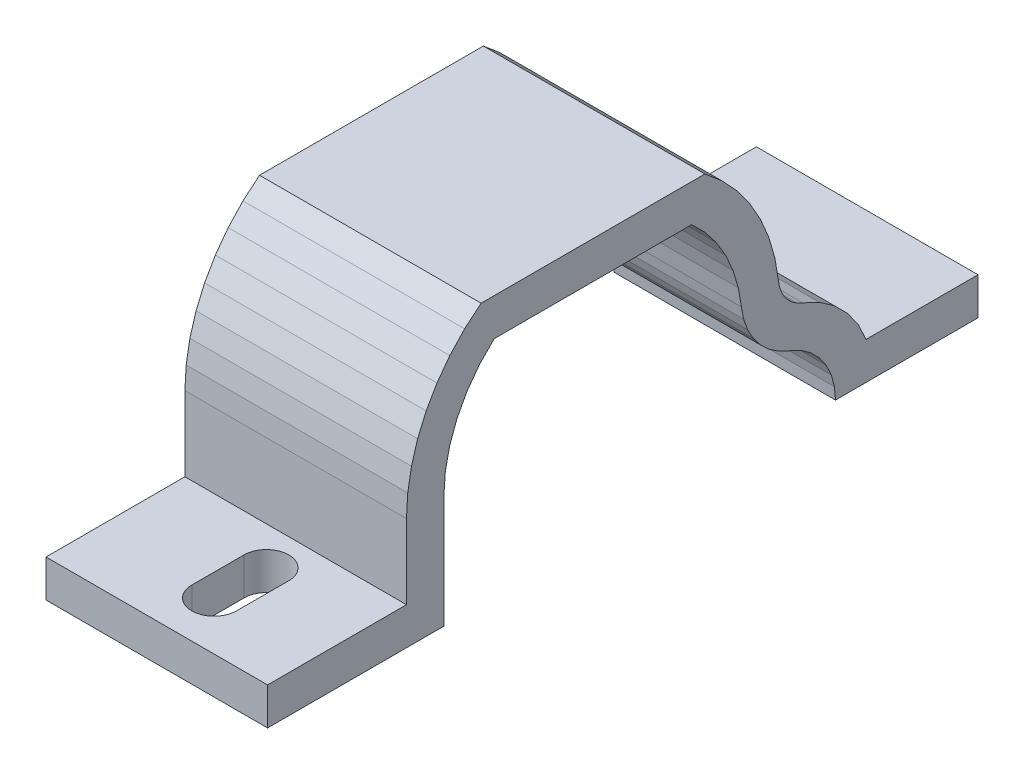
from build123d import *

# Parameters (mm, degrees)
CUT_EXTRUDE1_START   = -0.299999985
CUT_EXTRUDE1_DEPTH   = 0.099999976
CUT_EXTRUDE1_2_DEPTH = 0.624999986
CUT_EXTRUDE2_REACH   = 3.369
CUT_EXTRUDE3_DEPTH   = 0.099999976
CUT_EXTRUDE4_DEPTH   = 2.439835087
SKETCH8_W            = 0.45707022
SKETCH8_H            = 0.126497466
CUT_EXTRUDE5_DEPTH   = 2.36862159
BOSS_EXTRUDE1_DEPTH  = 0.3
SKETCH10_W           = 0.320867719
SKETCH10_H           = 0.471779159
BOSS_EXTRUDE2_DEPTH  = 0.1
CUT_EXTRUDE6_DEPTH   = 2.347497156
SKETCH12_W           = 0.905202631
SKETCH12_H           = 0.17588134
CUT_EXTRUDE7_DEPTH   = 2.347497156
SKETCH13_W           = 2.413938714
SKETCH13_H           = 1.247285026
CUT_EXTRUDE8_DEPTH   = 0.03
SKETCH14_W           = 2.254507246
SKETCH14_H           = 1.130570224
CUT_EXTRUDE9_DEPTH   = 0.001
SCALE1_SCALE         = 26


with BuildPart() as part:
    # Cut-Extrude1: read off the stored shape, not the designer's step
    # Cut-Extrude1 outline → Cut-Extrude1 (new body)
    with BuildSketch(Plane(origin=(0, 0, 0), x_dir=(-1, 0, 0), z_dir=(0, 1, 0)).offset(CUT_EXTRUDE1_START)):
        Polygon((-0.103293976, 1.023100922), (-0.125000006, 1.025000005), (-0.500000024, 1.025000005), (-0.52170601, 1.023100922), (-0.542752503, 1.017461531), (-0.562499976, 1.008253195), (-0.580348424, 0.995755661), (-0.595755526, 0.980348443), (-0.608253176, 0.962500053), (-0.61746157, 0.942752522), (-0.623101019, 0.921706087), (-0.624999986, 0.899999985), (-0.624999986, -1.025000005), (-0.623101019, -1.046706107), (-0.61746157, -1.067752484), (-0.608253176, -1.087500015), (-0.595755526, -1.105348463), (-0.580348424, -1.120755565), (-0.562499976, -1.133253216), (-0.542752503, -1.142461551), (-0.52170601, -1.148100942), (-0.500000024, -1.150000026), (-0.125000006, -1.150000026), (-0.103293976, -1.148100942), (-0.082247483, -1.142461551), (-0.062500003, -1.133253216), (-0.044651548, -1.120755565), (-0.029244446, -1.105348463), (-0.016746824, -1.087500015), (-0.007538422, -1.067752484), (-0.001899031, -1.046706107), (0, -1.025000005), (0, 0.899999985), (-0.001899031, 0.921706087), (-0.007538422, 0.942752522), (-0.016746824, 0.962500053), (-0.029244446, 0.980348443), (-0.044651548, 0.995755661), (-0.062500003, 1.008253195), (-0.082247483, 1.017461531), align=None)
    extrude(amount=CUT_EXTRUDE1_DEPTH)

    # Cut-Extrude1 2 outline → Cut-Extrude1 2 (add)
    with BuildSketch(Plane.YZ):
        Polygon((0.057826259, 0.496644876), (0, 0.500000024), (-0.200000009, 0.500000024), (-0.200000009, -0.73204824), (-0.155237081, -0.710894703), (-0.114767128, -0.682375045), (-0.079790305, -0.647334848), (-0.051343839, -0.60681341), (-0.030271342, -0.562012312), (-0.023619925, -0.547616393), (-0.014776401, -0.534452964), (-0.003963165, -0.522853108), (0.008547848, -0.513108505), (0.022442007, -0.505464152), (0.037369897, -0.500112365), (0.0529561, -0.497187721), (0.110784524, -0.487572339), (0.167090067, -0.471254607), (0.22109873, -0.448458857), (0.272068108, -0.41949845), (0.319297513, -0.384771498), (0.362137827, -0.344755303), (0.400000019, -0.299999985), (0.400000019, 0.299999985), (0.362620107, 0.344247906), (0.320373714, 0.383875886), (0.273827725, 0.418351992), (0.223606796, 0.447213592), (0.170384956, 0.47007337), (0.114876457, 0.486624485), align=None)
    extrude(amount=CUT_EXTRUDE1_2_DEPTH)

    # Sketch2 → Cut-Extrude2 (cut, up to next)
    with BuildSketch(Plane.ZY, mode=Mode.PRIVATE) as cut_extrude2_sk1:
        Polygon((-0.65000006, -0.299999985), (0.400000019, -0.299999985), (0.400000019, 0), (0.396011048, 0.056349407), (0.384123705, 0.11157494), (0.364575157, 0.164575133), (0.337755162, 0.214292915), (0.304198737, 0.259736669), (0.264575152, 0.299999985), (-0.264575152, 0.299999985), (-0.299557927, 0.265075563), (-0.329965871, 0.226102915), (-0.355334574, 0.183677243), (-0.375276693, 0.138446456), (-0.389487541, 0.091101319), (-0.397750206, 0.042364885), (-0.403599464, 0.011192467), (-0.414303038, -0.01866331), (-0.429591688, -0.046451623), (-0.449080922, -0.07147366), (-0.472280721, -0.093100134), (-0.498607522, -0.110787172), (-0.527399301, -0.124090002), (-0.556858547, -0.137973097), (-0.583471148, -0.15674415), (-0.606434362, -0.179836949), (-0.625055342, -0.20655476), (-0.638772442, -0.236091611), (-0.647171808, -0.267556432), align=None)
    cut_extrude2_tool1 = extrude(cut_extrude2_sk1.sketch, amount=-CUT_EXTRUDE2_REACH, mode=Mode.PRIVATE) & part.part
    add(cut_extrude2_tool1.solids().sort_by_distance((0, -0.029264, -0.044377))[0], mode=Mode.SUBTRACT)

    # Sketch3 → Cut-Extrude3 (cut)
    with BuildSketch(Plane(origin=(0, -0.200000009, 0), x_dir=(-1, 0, 0), z_dir=(0, 1, 0))):
        Polygon((-0.231526632, 0.946749991), (-0.240874855, 0.960100675), (-0.252399361, 0.971625152), (-0.265749986, 0.98097336), (-0.280521112, 0.987861305), (-0.296263897, 0.992079498), (-0.312499993, 0.993499998), (-0.328736118, 0.992079498), (-0.344478874, 0.987861305), (-0.359249971, 0.98097336), (-0.372600654, 0.971625152), (-0.38412516, 0.960100675), (-0.393473398, 0.946749991), (-0.400361256, 0.931978866), (-0.404579536, 0.91623608), (-0.405999977, 0.899999985), (-0.405999977, 0.713000074), (-0.404579536, 0.69676392), (-0.400361256, 0.681021134), (-0.393473398, 0.666250009), (-0.38412516, 0.652899384), (-0.372600654, 0.641374907), (-0.359249971, 0.63202664), (-0.344478874, 0.625138753), (-0.328736118, 0.620920502), (-0.312499993, 0.619500061), (-0.296263897, 0.620920502), (-0.280521112, 0.625138753), (-0.265749986, 0.63202664), (-0.252399361, 0.641374907), (-0.240874855, 0.652899384), (-0.231526632, 0.666250009), (-0.224638745, 0.681021134), (-0.220420479, 0.69676392), (-0.219000009, 0.713000074), (-0.219000009, 0.899999985), (-0.220420479, 0.91623608), (-0.224638745, 0.931978866), align=None)
    extrude(amount=-CUT_EXTRUDE3_DEPTH, mode=Mode.SUBTRACT)

    # Sketch4 → Cut-Extrude4 (cut, through all)
    with BuildSketch(Plane(origin=(0, -0.200000009, 0), x_dir=(-1, 0, 0), z_dir=(0, 1, 0))):
        Polygon((-0.393473398, -1.07175007), (-0.38412516, -1.085100695), (-0.372600654, -1.09662523), (-0.359249971, -1.105973381), (-0.344478874, -1.112861326), (-0.328736118, -1.117079635), (-0.312499993, -1.118500018), (-0.296263897, -1.117079635), (-0.280521112, -1.112861326), (-0.265749986, -1.105973381), (-0.252399361, -1.09662523), (-0.240874855, -1.085100695), (-0.231526632, -1.07175007), (-0.224638745, -1.056978945), (-0.220420479, -1.041236101), (-0.219000009, -1.025000005), (-0.219000009, -0.837999978), (-0.220420479, -0.821763941), (-0.224638745, -0.806021097), (-0.231526632, -0.791249971), (-0.240874855, -0.777899404), (-0.252399361, -0.766374869), (-0.265749986, -0.757026661), (-0.280521112, -0.750138774), (-0.296263897, -0.745920464), (-0.312499993, -0.744499965), (-0.328736118, -0.745920464), (-0.344478874, -0.750138774), (-0.359249971, -0.757026661), (-0.372600654, -0.766374869), (-0.38412516, -0.777899404), (-0.393473398, -0.791249971), (-0.400361256, -0.806021097), (-0.404579536, -0.821763941), (-0.405999977, -0.837999978), (-0.405999977, -1.025000005), (-0.404579536, -1.041236101), (-0.400361256, -1.056978945), align=None)
    extrude(amount=-CUT_EXTRUDE4_DEPTH, mode=Mode.SUBTRACT)

    # Sketch8 → Cut-Extrude5 (cut, through all)
    with BuildSketch(Plane(origin=(0, 0, 0), x_dir=(0, 0, -1), z_dir=(1, 0, 0))):
        with Locations((0.96058335, -0.263248742)):
            Rectangle(SKETCH8_W, SKETCH8_H)
    extrude(amount=CUT_EXTRUDE5_DEPTH, mode=Mode.SUBTRACT)

    # Sketch9 → Boss-Extrude1 (add)
    with BuildSketch(Plane(origin=(0, 0, -0.73204824), x_dir=(-1, 0, 0), z_dir=(0, 0, -1))):
        Polygon((0, -0.299999985), (0, -0.200000009), (-0.624999986, -0.200000009), (-0.624999986, -0.278120473), (-0.624999986, -0.299999985), (-0.529422539, -0.299999985), (-0.519709533, -0.299999985), (-0.506867205, -0.299999985), (-0.490512573, -0.299999985), (-0.470477371, -0.299999985), (-0.447049913, -0.299999985), (-0.421272081, -0.299999985), (-0.395156344, -0.299999985), (-0.371582464, -0.299999985), (-0.353676372, -0.299999985), (-0.271323614, -0.299999985), (-0.253417547, -0.299999985), (-0.229843642, -0.299999985), (-0.203727882, -0.299999985), (-0.177950094, -0.299999985), (-0.154522634, -0.299999985), (-0.134487439, -0.299999985), (-0.118132789, -0.299999985), (-0.105290467, -0.299999985), (-0.095577447, -0.299999985), (-0.047916146, -0.299999985), align=None)
    extrude(amount=BOSS_EXTRUDE1_DEPTH)

    # Sketch10 → Boss-Extrude2 (add, through all)
    with BuildSketch(Plane(origin=(0, -0.200000009, 0), x_dir=(-1, 0, 0), z_dir=(0, 1, 0))):
        with Locations((-0.31112302, 0.768217279)):
            Rectangle(SKETCH10_W, SKETCH10_H)
    extrude(amount=-BOSS_EXTRUDE2_DEPTH)

    # Sketch11 → Cut-Extrude6 (cut, through all)
    with BuildSketch(Plane(origin=(0, -0.200000009, 0), x_dir=(-1, 0, 0), z_dir=(0, 1, 0))):
        with BuildLine():
            Line((-0.381567202, 0.602069646), (-0.381567202, 0.742122646))
            ThreePointArc((-0.381567202, 0.742122646), (-0.321550512, 0.802139336), (-0.261533822, 0.742122646))
            Line((-0.261533822, 0.742122646), (-0.261533822, 0.602069646))
            ThreePointArc((-0.261533822, 0.602069646), (-0.321550512, 0.542052956), (-0.381567202, 0.602069646))
        make_face()
    extrude(amount=-CUT_EXTRUDE6_DEPTH, mode=Mode.SUBTRACT)

    # Sketch12 → Cut-Extrude7 (cut, through all)
    with BuildSketch(Plane(origin=(0, -0.200000009, 0), x_dir=(-1, 0, 0), z_dir=(0, 1, 0))):
        with Locations((-0.289049147, 0.960305627)):
            Rectangle(SKETCH12_W, SKETCH12_H)
    extrude(amount=-CUT_EXTRUDE7_DEPTH, mode=Mode.SUBTRACT)

    # Sketch13 → Cut-Extrude8 (cut)
    with BuildSketch(Plane(origin=(0.624999986, 0, 0), x_dir=(0, 0, -1), z_dir=(1, 0, 0))):
        Rectangle(SKETCH13_W, SKETCH13_H)
    extrude(amount=-CUT_EXTRUDE8_DEPTH, mode=Mode.SUBTRACT)

    # Sketch14 → Cut-Extrude9 (cut)
    with BuildSketch(Plane.ZY):
        Rectangle(SKETCH14_W, SKETCH14_H)
    extrude(amount=-CUT_EXTRUDE9_DEPTH, mode=Mode.SUBTRACT)


with BuildPart() as part_1:
    # Scale1: scaled about (0.297584829, 0.035955959, -0.052860466)
    add(part.part.scale(SCALE1_SCALE).moved(Location((-7.439620725, -0.898898975, 1.32151165))))


solid = part_1.part
